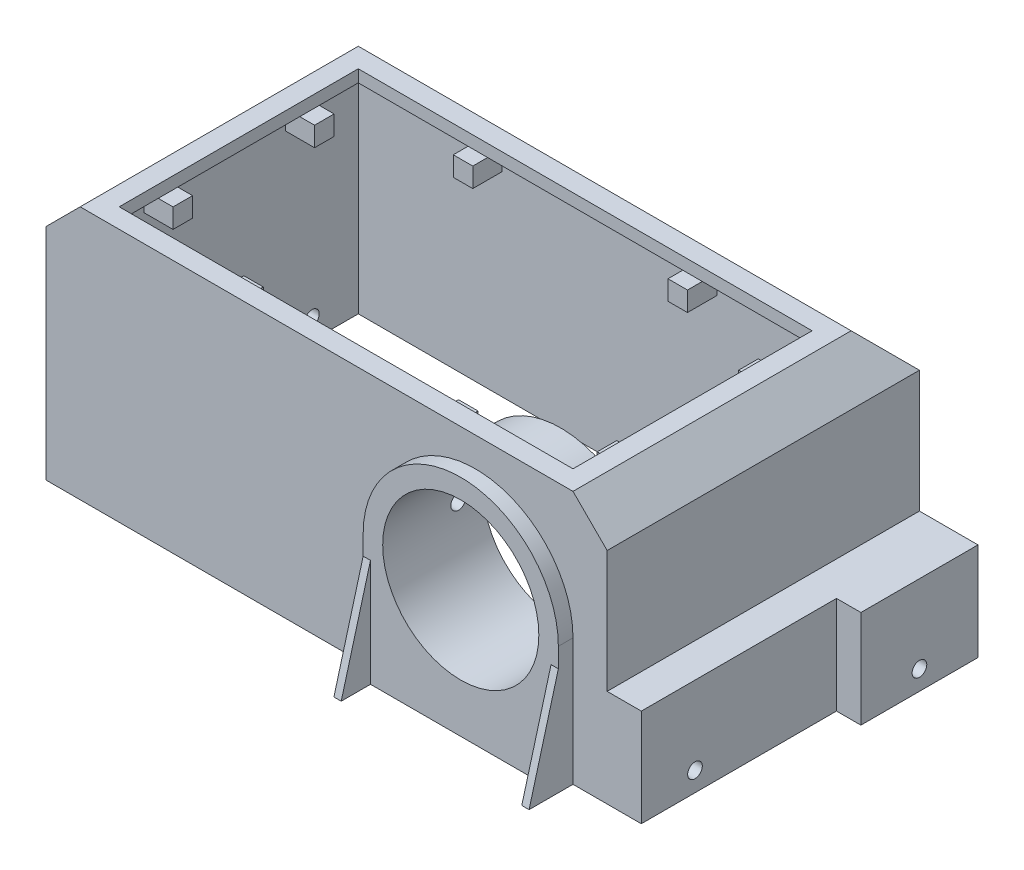
from build123d import *

# Parameters (mm, degrees)
BOSS_EXTRUDE1_DEPTH = 64
SKETCH2_R           = 20
SKETCH2_R_2         = 16
BOSS_EXTRUDE2_DEPTH = 3
CHAMFER1_SIZE       = 7
BOSS_EXTRUDE3_REACH = 97.902
SKETCH4_W           = 1.5
SKETCH4_H           = 22
BOSS_EXTRUDE4_DEPTH = 6
CUT_EXTRUDE1_DEPTH  = 104.097041665
SKETCH6_W           = 5
SKETCH6_H           = 40
CUT_EXTRUDE2_DEPTH  = 102.908046787
SHELL1_START        = 2.5
SHELL1_DEPTH        = 59
SHELL1_2_OUTLINE_W  = 5
SHELL1_2_OUTLINE_H  = 17.5
SHELL1_2_DEPTH      = 19
SHELL1_START_2      = 61.5
SHELL1_3_DEPTH      = 3
SHELL1_START_3      = 10.935028843
SHELL1_4_DEPTH      = 2.5
CUT_EXTRUDE3_REACH  = 95.831
SKETCH7_R           = 16
BOSS_EXTRUDE5_START = 15
SKETCH8_R           = 16
BOSS_EXTRUDE5_DEPTH = 15
CUT_EXTRUDE4_REACH  = 111.842
SKETCH9_W           = 93
SKETCH9_H           = 49
SKETCH10_W          = 6
SKETCH10_H          = 4
SKETCH10_W_2        = 4
SKETCH10_H_2        = 6
BOSS_EXTRUDE6_DEPTH = 4
SKETCH11_R          = 1.5
CUT_EXTRUDE5_DEPTH  = 149.7749979
SKETCH12_R          = 1.55
CUT_EXTRUDE6_DEPTH  = 44


with BuildPart() as part:
    # Sketch1 → Boss-Extrude1 (new body)
    with BuildSketch(Plane.XY):
        Polygon((63.5, -26), (63.5, -6), (51.5, -6), (51.5, 26), (-63.5, 26), (-63.5, -26), align=None)
    extrude(amount=BOSS_EXTRUDE1_DEPTH)

    # Sketch2 → Boss-Extrude2 (add)
    with BuildSketch(Plane.XY.offset(64)):
        with Locations((24.5, 0)):
            Circle(SKETCH2_R)
        with Locations((24.5, 0)):
            Circle(SKETCH2_R_2, mode=Mode.SUBTRACT)
    extrude(amount=BOSS_EXTRUDE2_DEPTH)

    # Chamfer1
    chamfer1_edges = [part.edges().sort_by_distance(p)[0] for p in [
        (-63.5, 26, 32),
        (51.5, 26, 32),
        (-6, 26, 0),
    ]]
    chamfer(chamfer1_edges, length=CHAMFER1_SIZE)

    # Sketch3 → Boss-Extrude3 (add, up to next)
    with BuildSketch(Plane.XY.offset(67), mode=Mode.PRIVATE) as boss_extrude3_sk1:
        with BuildLine():
            ThreePointArc((6.5, -8.717797887), (5.00641131, -4.472135955), (4.5, 0))
            Line((4.5, 0), (4.5, -26))
            Line((4.5, -26), (6.5, -26))
            Line((6.5, -26), (6.5, -8.717797887))
        make_face()
    boss_extrude3_tool1 = extrude(boss_extrude3_sk1.sketch, amount=-BOSS_EXTRUDE3_REACH, mode=Mode.PRIVATE) - part.part
    # Sketch3 → Boss-Extrude3 (add, up to next)
    with BuildSketch(Plane.XY.offset(67), mode=Mode.PRIVATE) as boss_extrude3_sk2:
        with BuildLine():
            Line((44.5, -26), (44.5, 0))
            ThreePointArc((44.5, 0), (43.99358869, -4.472135955), (42.5, -8.717797887))
            Line((42.5, -8.717797887), (42.5, -26))
            Line((42.5, -26), (44.5, -26))
        make_face()
    boss_extrude3_tool2 = extrude(boss_extrude3_sk2.sketch, amount=-BOSS_EXTRUDE3_REACH, mode=Mode.PRIVATE) - part.part
    # Sketch3 → Boss-Extrude3 (add, up to next)
    with BuildSketch(Plane.XY.offset(67), mode=Mode.PRIVATE) as boss_extrude3_sk3:
        with BuildLine():
            ThreePointArc((42.5, -8.717797887), (24.5, -20), (6.5, -8.717797887))
            Line((6.5, -8.717797887), (6.5, -26))
            Line((6.5, -26), (42.5, -26))
            Line((42.5, -26), (42.5, -8.717797887))
        make_face()
    boss_extrude3_tool3 = extrude(boss_extrude3_sk3.sketch, amount=-BOSS_EXTRUDE3_REACH, mode=Mode.PRIVATE) - part.part
    add(boss_extrude3_tool1.solids().sort_by_distance((5.442676, -15.832473, 67))[0])
    add(boss_extrude3_tool2.solids().sort_by_distance((43.557324, -15.832473, 67))[0])
    add(boss_extrude3_tool3.solids().sort_by_distance((24.5, -20.87134, 67))[0])

    # Sketch4 → Boss-Extrude4 (add)
    with BuildSketch(Plane.XY.offset(67)):
        with Locations((43.75, -15)):
            Rectangle(SKETCH4_W, SKETCH4_H)
        with Locations((5.25, -15)):
            Rectangle(SKETCH4_W, SKETCH4_H)
    extrude(amount=BOSS_EXTRUDE4_DEPTH)

    # Sketch5 → Cut-Extrude1 (cut, through all)
    with BuildSketch(Plane.ZY.offset(-4.5)):
        Polygon((67, -4), (73, -26), (73, -4), align=None)
    extrude(amount=-CUT_EXTRUDE1_DEPTH, mode=Mode.SUBTRACT)

    # Sketch6 → Cut-Extrude2 (cut, through all)
    with BuildSketch(Plane(origin=(0, -6, 0), x_dir=(1, 0, 0), z_dir=(0, 1, 0))):
        with Locations((61, -44)):
            Rectangle(SKETCH6_W, SKETCH6_H)
    extrude(amount=-CUT_EXTRUDE2_DEPTH, mode=Mode.SUBTRACT)

    # Shell1: read off the stored shape, not the designer's step
    # Shell1 outline → Shell1 (cut)
    with BuildSketch(Plane.XY.offset(SHELL1_START)):
        Polygon((56, -8.5), (49, -8.5), (49, 17.964466094), (43.464466094, 23.5), (-55.464466094, 23.5), (-61, 17.964466094), (-61, -26), (56, -26), align=None)
    extrude(amount=SHELL1_DEPTH, mode=Mode.SUBTRACT)

    # Shell1 2 outline → Shell1 2 (cut)
    with BuildSketch(Plane.XY.offset(SHELL1_START)):
        with Locations((58.5, -17.25)):
            Rectangle(SHELL1_2_OUTLINE_W, SHELL1_2_OUTLINE_H)
    extrude(amount=SHELL1_2_DEPTH, mode=Mode.SUBTRACT)

    # Shell1 3 outline → Shell1 3 (cut)
    with BuildSketch(Plane.XY.offset(SHELL1_START_2)):
        with BuildLine():
            Line((7, -26), (42, -26))
            Line((42, -26), (42, -6))
            ThreePointArc((42, -6), (24.5, -18.5), (7, -6))
            Line((7, -6), (7, -26))
        make_face()
    extrude(amount=SHELL1_3_DEPTH, mode=Mode.SUBTRACT)

    # Shell1 4 outline → Shell1 4 (add)
    with BuildSketch(Plane(origin=(0, 0, 0), x_dir=(1, 0, 0), z_dir=(0, 0.707106781186545, -0.70710678118655)).offset(SHELL1_START_3)):
        Polygon((43.464466094, -22.298989873), (49, -14.470562748), (-61, -14.470562748), (-55.464466094, -22.298989873), align=None)
    extrude(amount=SHELL1_4_DEPTH)

    # Sketch7 → Cut-Extrude3 (cut, up to next)
    with BuildSketch(Plane.XY.offset(64), mode=Mode.PRIVATE) as cut_extrude3_sk1:
        with Locations((24.5, 0)):
            Circle(SKETCH7_R)
    cut_extrude3_tool1 = extrude(cut_extrude3_sk1.sketch, amount=-CUT_EXTRUDE3_REACH, mode=Mode.PRIVATE) & part.part
    add(cut_extrude3_tool1.solids().sort_by_distance((24.5, 0, 64))[0], mode=Mode.SUBTRACT)

    # Sketch8 → Boss-Extrude5 (add)
    with BuildSketch(Plane(origin=(0, 0, 61.5), x_dir=(-1, 0, 0), z_dir=(0, 0, -1)).offset(BOSS_EXTRUDE5_START)):
        with BuildLine():
            ThreePointArc((-6, 0), (-27.541381265, 18.248287591), (-42, -6))
            ThreePointArc((-42, -6), (-24.5, -18.5), (-7, -6))
            ThreePointArc((-7, -6), (-6.251712409, -3.041381265), (-6, 0))
        make_face()
        with Locations((-24.5, 0)):
            Circle(SKETCH8_R, mode=Mode.SUBTRACT)
    extrude(amount=-BOSS_EXTRUDE5_DEPTH)

    # Sketch9 → Cut-Extrude4 (cut, up to next)
    with BuildSketch(Plane(origin=(0, 26, 0), x_dir=(1, 0, 0), z_dir=(0, 1, 0)), mode=Mode.PRIVATE) as cut_extrude4_sk1:
        with Locations((-6, -35.5)):
            Rectangle(SKETCH9_W, SKETCH9_H)
    cut_extrude4_tool1 = extrude(cut_extrude4_sk1.sketch, amount=-CUT_EXTRUDE4_REACH, mode=Mode.PRIVATE) & part.part
    add(cut_extrude4_tool1.solids().sort_by_distance((-6, 26, 35.5))[0], mode=Mode.SUBTRACT)

    # Sketch10 → Boss-Extrude6 (add)
    with BuildSketch(Plane.XZ.offset(-23.5)):
        with Locations((-52.464466094, 50)):
            Rectangle(SKETCH10_W, SKETCH10_H)
        with Locations((-52.464466094, 21)):
            Rectangle(SKETCH10_W, SKETCH10_H)
        with Locations((40.464466094, 21)):
            Rectangle(SKETCH10_W, SKETCH10_H)
        with Locations((40.464466094, 50)):
            Rectangle(SKETCH10_W, SKETCH10_H)
        with Locations((-28, 11.035533906)):
            Rectangle(SKETCH10_W_2, SKETCH10_H_2)
        with Locations((16, 11.035533906)):
            Rectangle(SKETCH10_W_2, SKETCH10_H_2)
        with Locations((16, 59.964466094)):
            Rectangle(SKETCH10_W_2, SKETCH10_H_2)
        with Locations((-28, 59.964466094)):
            Rectangle(SKETCH10_W_2, SKETCH10_H_2)
    extrude(amount=BOSS_EXTRUDE6_DEPTH)

    # Sketch11 → Cut-Extrude5 (cut, through all)
    with BuildSketch(Plane.ZY.offset(63.5)):
        with Locations(Location((53, -22, 0), (0, 0, 270))):
            Circle(SKETCH11_R)
        with Locations((12, -22)):
            Circle(SKETCH11_R)
    extrude(amount=-CUT_EXTRUDE5_DEPTH, mode=Mode.SUBTRACT)

    # Sketch12 → Cut-Extrude6 (cut)
    with BuildSketch(Plane(origin=(0, 0, 0), x_dir=(0, 0, -1), z_dir=(1, 0, 0))):
        with Locations(Location((-51.5, 0, 0), (0, 0, 180))):
            Circle(SKETCH12_R)
    extrude(amount=CUT_EXTRUDE6_DEPTH, mode=Mode.SUBTRACT)


solid = part.part
